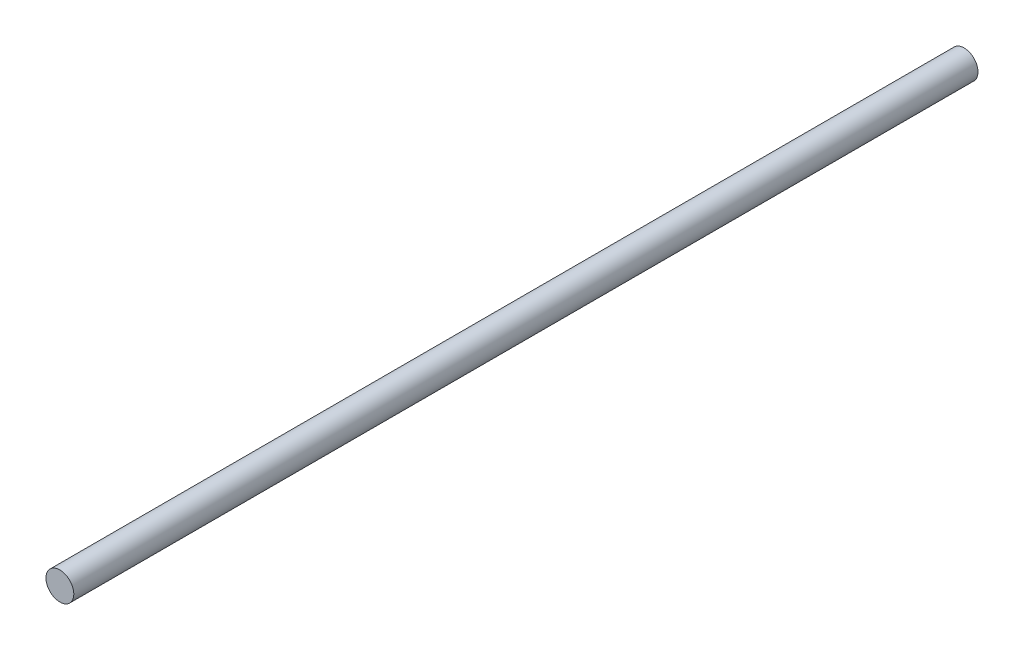
from build123d import *

# Parameters (mm, degrees)
SKETCH1_R           = 6
BOSS_EXTRUDE1_DEPTH = 195


with BuildPart() as part:
    # Sketch1 → Boss-Extrude1 (new, symmetric)
    with BuildSketch(Plane.XY):
        Circle(SKETCH1_R)
    extrude(amount=BOSS_EXTRUDE1_DEPTH, both=True)


solid = part.part
